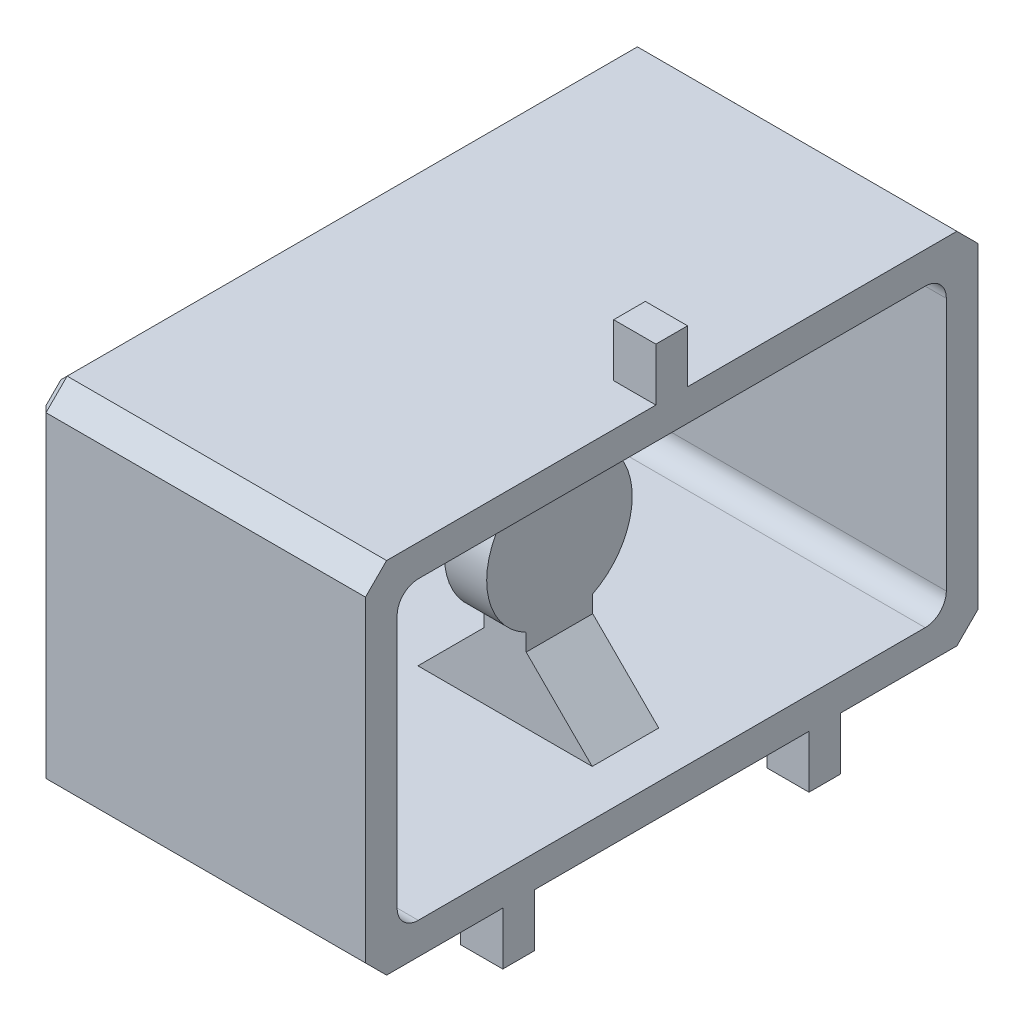
from build123d import *

# Parameters (mm, degrees)
SKETCH2_W             = 14.732
SKETCH2_H             = 8.636
SKETCH2_W_2           = 13.208
SKETCH2_H_2           = 7.112
EXTRUDE_THIN1_DEPTH   = 7.9375
SKETCH3_W             = 14.732
SKETCH3_H             = 8.636
BOSS_EXTRUDE1_DEPTH   = 1.27
CUT_EXTRUDE1_REACH    = 71.359
SKETCH4_W             = 3.949
SKETCH4_H             = 7.112
SKETCH7_R             = 1.016
BOSS_EXTRUDE2_DEPTH   = 1.27
F_0_80_TAPPED_HOLE1_D = 1.19126
SKETCH9_W             = 0.762
SKETCH9_H             = 1.27
EXTRUDE_THIN2_DEPTH   = 1.27
FILLET1_R             = 0.508
CHAMFER1_SIZE         = 0.508
CHAMFER2_SIZE         = 0.254
BOSS_EXTRUDE3_START   = -3.7165
BOSS_EXTRUDE3_DEPTH   = 1.016
CUT_EXTRUDE2_REACH    = 72.592
CUT_EXTRUDE3_REACH    = 72.34
CHAMFER3_SIZE         = 1.5875


with BuildPart() as part:
    # Sketch2 → Extrude-Thin1 (new body)
    with BuildSketch(Plane(origin=(-2.794, 0, 0), x_dir=(0, 0, -1), z_dir=(1, 0, 0))):
        with Locations((-7.366, -62.992)):
            Rectangle(SKETCH2_W, SKETCH2_H)
        with Locations((-7.366, -62.992)):
            Rectangle(SKETCH2_W_2, SKETCH2_H_2, mode=Mode.SUBTRACT)
    extrude(amount=EXTRUDE_THIN1_DEPTH)

    # Sketch3 → Boss-Extrude1 (add)
    with BuildSketch(Plane(origin=(5.1435, 0, 0), x_dir=(0, 0, -1), z_dir=(1, 0, 0))):
        with Locations((-7.366, -62.992)):
            Rectangle(SKETCH3_W, SKETCH3_H)
    extrude(amount=-BOSS_EXTRUDE1_DEPTH)

    # Sketch4 → Cut-Extrude1 (cut, up to next)
    with BuildSketch(Plane(origin=(5.1435, 0, 0), x_dir=(0, 0, -1), z_dir=(1, 0, 0)), mode=Mode.PRIVATE) as cut_extrude1_sk1:
        with Locations((-2.7365, -62.992)):
            Rectangle(SKETCH4_W, SKETCH4_H)
    cut_extrude1_tool1 = extrude(cut_extrude1_sk1.sketch, amount=-CUT_EXTRUDE1_REACH, mode=Mode.PRIVATE) & part.part
    # Sketch4 → Cut-Extrude1 (cut, up to next)
    with BuildSketch(Plane(origin=(5.1435, 0, 0), x_dir=(0, 0, -1), z_dir=(1, 0, 0)), mode=Mode.PRIVATE) as cut_extrude1_sk2:
        with Locations((-11.9955, -62.992)):
            Rectangle(SKETCH4_W, SKETCH4_H)
    cut_extrude1_tool2 = extrude(cut_extrude1_sk2.sketch, amount=-CUT_EXTRUDE1_REACH, mode=Mode.PRIVATE) & part.part
    add(cut_extrude1_tool1.solids().sort_by_distance((5.1435, -62.992, 2.7365))[0], mode=Mode.SUBTRACT)
    add(cut_extrude1_tool2.solids().sort_by_distance((5.1435, -62.992, 11.9955))[0], mode=Mode.SUBTRACT)

    # Sketch7 → Boss-Extrude2 (add)
    with BuildSketch(Plane.ZY.offset(-3.8735)):
        with Locations((7.366, -62.992)):
            Circle(SKETCH7_R)
    extrude(amount=BOSS_EXTRUDE2_DEPTH)

    # #0-80 Tapped Hole1 (through all)
    with Locations(Plane(origin=(5.1435, 0, 0), x_dir=(0, 0, -1), z_dir=(1, 0, 0))):
        with Locations((-7.366, -62.992)):
            Hole(F_0_80_TAPPED_HOLE1_D / 2)

    # Sketch9 → Extrude-Thin2 (add)
    with BuildSketch(Plane(origin=(5.1435, 0, 0), x_dir=(0, 0, -1), z_dir=(1, 0, 0))):
        with Locations((-7.366, -58.039)):
            Rectangle(SKETCH9_W, SKETCH9_H)
        with Locations((-11.049, -67.945)):
            Rectangle(SKETCH9_W, SKETCH9_H)
        with Locations((-3.683, -67.945)):
            Rectangle(SKETCH9_W, SKETCH9_H)
    extrude(amount=-EXTRUDE_THIN2_DEPTH)

    # Fillet1
    fillet1_edges = [part.edges().sort_by_distance(p)[0] for p in [
        (3.8735, -66.548, 7.366),
        (1.17475, -59.436, 13.97),
        (1.17475, -59.436, 0.762),
        (1.17475, -66.548, 0.762),
        (3.8735, -59.436, 7.366),
        (1.17475, -66.548, 13.97),
        (4.5085, -59.436, 10.021),
        (4.5085, -59.436, 4.711),
        (4.5085, -66.548, 4.711),
        (4.5085, -66.548, 10.021),
        (3.8735, -62.992, 6.35),
    ]]
    fillet(fillet1_edges, radius=FILLET1_R)

    # Chamfer1
    chamfer1_edges = [part.edges().sort_by_distance(p)[0] for p in [
        (1.17475, -67.31, 14.732),
        (1.17475, -67.31, 0),
        (1.17475, -58.674, 0),
        (1.17475, -58.674, 14.732),
    ]]
    chamfer(chamfer1_edges, length=CHAMFER1_SIZE)

    # Chamfer2
    chamfer2_edges = [part.edges().sort_by_distance(p)[0] for p in [
        (-2.794, -67.056, 14.478),
        (-2.794, -67.31, 7.366),
        (-2.794, -67.056, 0.254),
        (-2.794, -62.992, 0),
        (-2.794, -58.928, 0.254),
        (-2.794, -62.992, 14.732),
        (-2.794, -58.928, 14.478),
        (-2.794, -58.674, 7.366),
        (3.8735, -58.039, 6.985),
        (3.8735, -57.404, 7.366),
        (3.8735, -58.039, 7.747),
        (3.8735, -67.945, 10.668),
        (3.8735, -68.58, 11.049),
        (3.8735, -67.945, 11.43),
        (3.8735, -67.945, 3.302),
        (3.8735, -68.58, 3.683),
        (3.8735, -67.945, 4.064),
    ]]
    chamfer(chamfer2_edges, length=CHAMFER2_SIZE)

    # Sketch10 → Boss-Extrude3 (add)
    with BuildSketch(Plane(origin=(5.1435, 0, 0), x_dir=(0, 0, -1), z_dir=(1, 0, 0)).offset(BOSS_EXTRUDE3_START)):
        with BuildLine():
            Line((-4.711, -59.944), (-4.711, -66.04))
            ThreePointArc((-4.711, -66.04), (-4.562210245, -66.399210245), (-4.203, -66.548))
            Line((-4.203, -66.548), (-10.529, -66.548))
            ThreePointArc((-10.529, -66.548), (-10.169789755, -66.399210245), (-10.021, -66.04))
            Line((-10.021, -66.04), (-10.021, -59.944))
            ThreePointArc((-10.021, -59.944), (-10.169789755, -59.584789755), (-10.529, -59.436))
            Line((-10.529, -59.436), (-4.203, -59.436))
            ThreePointArc((-4.203, -59.436), (-4.562210245, -59.584789755), (-4.711, -59.944))
        make_face()
    extrude(amount=BOSS_EXTRUDE3_DEPTH)

    # Sketch10<2> → Cut-Extrude2 (cut, up to next)
    with BuildSketch(Plane(origin=(5.1435, 0, 0), x_dir=(0, 0, -1), z_dir=(1, 0, 0)), mode=Mode.PRIVATE) as cut_extrude2_sk1:
        with BuildLine():
            Line((-4.711, -59.944), (-4.711, -66.04))
            ThreePointArc((-4.711, -66.04), (-4.562210245, -66.399210245), (-4.203, -66.548))
            Line((-4.203, -66.548), (-10.529, -66.548))
            ThreePointArc((-10.529, -66.548), (-10.169789755, -66.399210245), (-10.021, -66.04))
            Line((-10.021, -66.04), (-10.021, -59.944))
            ThreePointArc((-10.021, -59.944), (-10.169789755, -59.584789755), (-10.529, -59.436))
            Line((-10.529, -59.436), (-4.203, -59.436))
            ThreePointArc((-4.203, -59.436), (-4.562210245, -59.584789755), (-4.711, -59.944))
        make_face()
    cut_extrude2_tool1 = extrude(cut_extrude2_sk1.sketch, amount=-CUT_EXTRUDE2_REACH, mode=Mode.PRIVATE) & part.part
    add(cut_extrude2_tool1.solids().sort_by_distance((5.1435, -62.992, 7.366))[0], mode=Mode.SUBTRACT)

    # Sketch11 → Cut-Extrude3 (cut, up to next)
    with BuildSketch(Plane(origin=(2.443, 0, 0), x_dir=(0, 0, -1), z_dir=(1, 0, 0)), mode=Mode.PRIVATE) as cut_extrude3_sk1:
        with BuildLine():
            Line((-8.166, -59.436), (-8.166, -61.435561758))
            ThreePointArc((-8.166, -61.435561758), (-9.116, -62.992), (-8.166, -64.548438242))
            Line((-8.166, -64.548438242), (-8.166, -66.548))
            Line((-8.166, -66.548), (-10.529, -66.548))
            ThreePointArc((-10.529, -66.548), (-10.169789755, -66.399210245), (-10.021, -66.04))
            Line((-10.021, -66.04), (-10.021, -59.944))
            ThreePointArc((-10.021, -59.944), (-10.169789755, -59.584789755), (-10.529, -59.436))
            Line((-10.529, -59.436), (-8.166, -59.436))
        make_face()
    cut_extrude3_tool1 = extrude(cut_extrude3_sk1.sketch, amount=-CUT_EXTRUDE3_REACH, mode=Mode.PRIVATE) & part.part
    # Sketch11 → Cut-Extrude3 (cut, up to next)
    with BuildSketch(Plane(origin=(2.443, 0, 0), x_dir=(0, 0, -1), z_dir=(1, 0, 0)), mode=Mode.PRIVATE) as cut_extrude3_sk2:
        with BuildLine():
            Line((-4.711, -66.04), (-4.711, -59.944))
            ThreePointArc((-4.711, -59.944), (-4.562210245, -59.584789755), (-4.203, -59.436))
            Line((-4.203, -59.436), (-6.566, -59.436))
            Line((-6.566, -59.436), (-6.566, -61.435561758))
            ThreePointArc((-6.566, -61.435561758), (-5.616, -62.992), (-6.566, -64.548438242))
            Line((-6.566, -64.548438242), (-6.566, -66.548))
            Line((-6.566, -66.548), (-4.203, -66.548))
            ThreePointArc((-4.203, -66.548), (-4.562210245, -66.399210245), (-4.711, -66.04))
        make_face()
    cut_extrude3_tool2 = extrude(cut_extrude3_sk2.sketch, amount=-CUT_EXTRUDE3_REACH, mode=Mode.PRIVATE) & part.part
    add(cut_extrude3_tool1.solids().sort_by_distance((2.443, -62.992, 9.205105))[0], mode=Mode.SUBTRACT)
    add(cut_extrude3_tool2.solids().sort_by_distance((2.443, -62.992, 5.526895))[0], mode=Mode.SUBTRACT)

    # Chamfer3
    chamfer3_edges = [part.edges().sort_by_distance(p)[0] for p in [
        (2.443, -59.436, 7.366),
        (2.443, -66.548, 7.366),
        (1.427, -66.548, 7.366),
        (1.427, -59.436, 7.366),
    ]]
    chamfer(chamfer3_edges, length=CHAMFER3_SIZE)


solid = part.part
